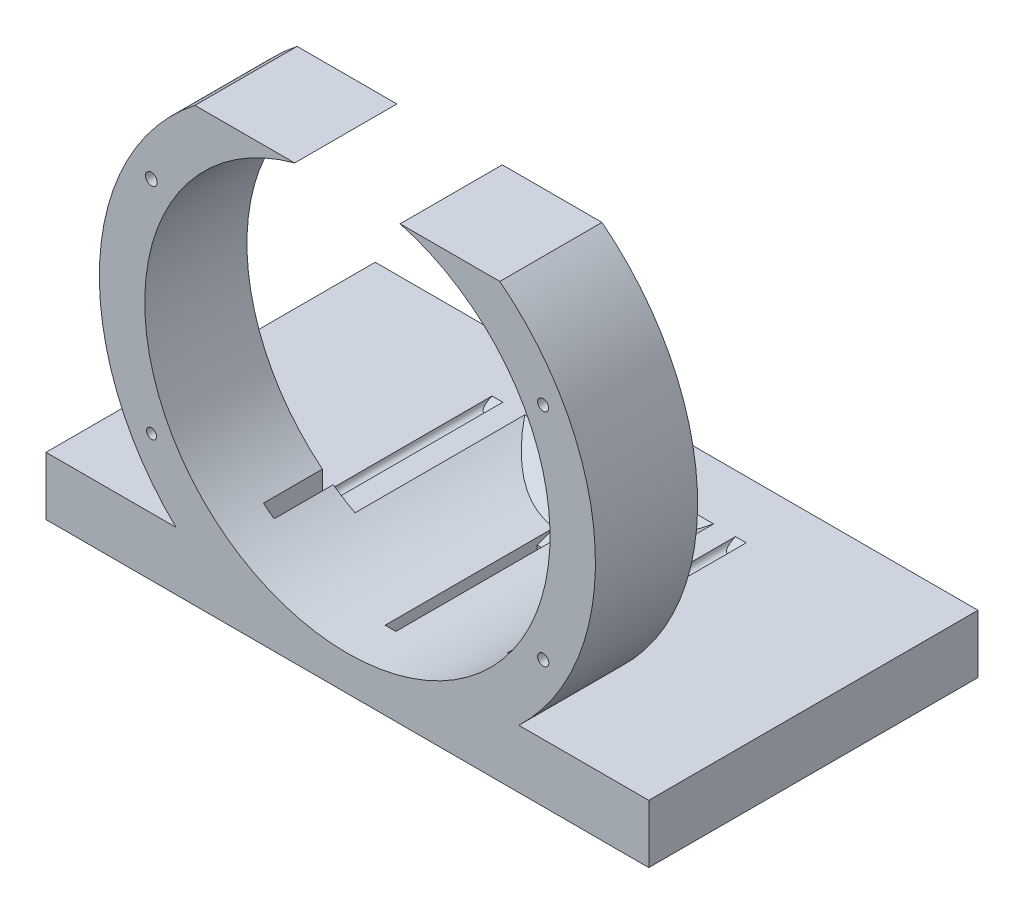
from build123d import *

# Parameters (mm, degrees)
SKETCH1_R           = 1.119854884
SKETCH1_R_2         = 1.251086703
SKETCH1_R_3         = 1.312287122
SKETCH1_R_4         = 1.226343403
BOSS_EXTRUDE1_DEPTH = 22.86
BOSS_EXTRUDE2_START = 50.8
BOSS_EXTRUDE2_DEPTH = 50.8
CUT_EXTRUDE1_DEPTH  = 13.208
BOSS_EXTRUDE3_START = -9.652
BOSS_EXTRUDE3_DEPTH = 9.652
BOSS_EXTRUDE5_DEPTH = 116.84


with BuildPart() as part:
    # Sketch1 → Boss-Extrude1 (new body)
    with BuildSketch(Plane.XY):
        with BuildLine():
            Line((-11.793911232, 43.778174686), (-34.111734376, 43.778174686))
            ThreePointArc((-34.111734376, 43.778174686), (-55.42808501, 2.8047091), (-38.356610074, -40.111213702))
            Line((-38.356610074, -40.111213702), (-67.436307144, -40.111213702))
            Line((-67.436307144, -40.111213702), (-67.436307144, -53.154130962))
            Line((-67.436307144, -53.154130962), (67.436307144, -53.154130962))
            Line((67.436307144, -53.154130962), (67.436307144, -40.111213702))
            Line((67.436307144, -40.111213702), (38.356610074, -40.111213702))
            ThreePointArc((38.356610074, -40.111213702), (55.42808501, 2.8047091), (34.111734376, 43.778174686))
            Line((34.111734376, 43.778174686), (11.793911232, 43.778174686))
            ThreePointArc((11.793911232, 43.778174686), (44.365867188, 9.343165933), (28.448, -35.303487321))
            Line((28.448, -35.303487321), (28.448, -40.084313616))
            ThreePointArc((28.448, -40.084313616), (27.2415, -41.290813616), (26.035, -40.084313616))
            Line((26.035, -40.084313616), (26.035, -37.118778213))
            ThreePointArc((26.035, -37.118778213), (14.225045371, -43.049657434), (1.2065, -45.322944286))
            Line((1.2065, -45.322944286), (1.2065, -49.1871))
            ThreePointArc((1.2065, -49.1871), (0, -50.3936), (-1.2065, -49.1871))
            Line((-1.2065, -49.1871), (-1.2065, -45.322944286))
            ThreePointArc((-1.2065, -45.322944286), (-14.225045371, -43.049657434), (-26.035, -37.118778213))
            Line((-26.035, -37.118778213), (-26.035, -40.084313616))
            ThreePointArc((-26.035, -40.084313616), (-27.2415, -41.290813616), (-28.448, -40.084313616))
            Line((-28.448, -40.084313616), (-28.448, -35.303487321))
            ThreePointArc((-28.448, -35.303487321), (-44.365867188, 9.343165933), (-11.793911232, 43.778174686))
        make_face()
        with Locations((-43.815, -24.676814501)):
            Circle(SKETCH1_R, mode=Mode.SUBTRACT)
        with Locations((43.815, -24.676814501)):
            Circle(SKETCH1_R_2, mode=Mode.SUBTRACT)
        with Locations((-43.8731923, 24.631372396)):
            Circle(SKETCH1_R_3, mode=Mode.SUBTRACT)
        with Locations((43.791398207, 24.695162459)):
            Circle(SKETCH1_R_4, mode=Mode.SUBTRACT)
    extrude(amount=BOSS_EXTRUDE1_DEPTH)

    # Sketch2 → Boss-Extrude2 (add)
    with BuildSketch(Plane(origin=(0, 0, 0), x_dir=(-1, 0, 0), z_dir=(0, 0, -1)).offset(BOSS_EXTRUDE2_START)):
        with BuildLine():
            Line((21.135644215, -40.111213702), (26.035299919, -40.111213702))
            ThreePointArc((26.035299919, -40.111213702), (27.2415, -41.290813616), (28.447700081, -40.111213702))
            Line((28.447700081, -40.111213702), (67.436307144, -40.111213702))
            Line((67.436307144, -40.111213702), (67.436307144, -53.154130962))
            Line((67.436307144, -53.154130962), (-67.436307144, -53.154130962))
            Line((-67.436307144, -53.154130962), (-67.436307144, -40.111213702))
            Line((-67.436307144, -40.111213702), (-28.447700081, -40.111213702))
            ThreePointArc((-28.447700081, -40.111213702), (-27.2415, -41.290813616), (-26.035299919, -40.111213702))
            Line((-26.035299919, -40.111213702), (-21.135644215, -40.111213702))
            ThreePointArc((-21.135644215, -40.111213702), (-11.470980165, -43.863897855), (-1.2065, -45.322944286))
            Line((-1.2065, -45.322944286), (-1.2065, -49.1871))
            ThreePointArc((-1.2065, -49.1871), (0, -50.3936), (1.2065, -49.1871))
            Line((1.2065, -49.1871), (1.2065, -45.322944286))
            ThreePointArc((1.2065, -45.322944286), (11.470980165, -43.863897855), (21.135644215, -40.111213702))
        make_face()
    extrude(amount=-BOSS_EXTRUDE2_DEPTH)

    # Sketch3 → Cut-Extrude1 (cut)
    with BuildSketch(Plane(origin=(0, 0, 0), x_dir=(-1, 0, 0), z_dir=(0, 0, -1))):
        with BuildLine():
            ThreePointArc((-26.035, 40.255386447), (-27.2415, 41.461886447), (-28.448, 40.255386447))
            Line((-28.448, 40.255386447), (-28.448, 35.270861075))
            Line((-28.448, 35.270861075), (-26.035, 37.08774892))
            Line((-26.035, 37.08774892), (-26.035, 40.255386447))
        make_face()
        with BuildLine():
            Line((28.448, 35.303487321), (28.448, 40.255386447))
            ThreePointArc((28.448, 40.255386447), (27.2415, 41.461886447), (26.035, 40.255386447))
            Line((26.035, 40.255386447), (26.079183289, 37.08774892))
            ThreePointArc((26.079183289, 37.08774892), (27.278184081, 36.214991292), (28.448, 35.303487321))
        make_face()
    extrude(amount=-CUT_EXTRUDE1_DEPTH, mode=Mode.SUBTRACT)

    # Sketch4 → Boss-Extrude3 (add)
    with BuildSketch(Plane.XY.offset(22.86).offset(BOSS_EXTRUDE3_START)):
        with BuildLine():
            ThreePointArc((-28.448, -40.084313616), (-27.2415, -41.290813616), (-26.035, -40.084313616))
            Line((-26.035, -40.084313616), (-26.035, -37.118778213))
            ThreePointArc((-26.035, -37.118778213), (-27.25661649, -36.231226566), (-28.448, -35.303487321))
            Line((-28.448, -35.303487321), (-28.448, -40.084313616))
        make_face()
        with BuildLine():
            ThreePointArc((1.2065, -45.322944286), (0, -45.339), (-1.2065, -45.322944286))
            Line((-1.2065, -45.322944286), (-1.2065, -49.1871))
            ThreePointArc((-1.2065, -49.1871), (0, -50.3936), (1.2065, -49.1871))
            Line((1.2065, -49.1871), (1.2065, -45.322944286))
        make_face()
        with BuildLine():
            ThreePointArc((26.035, -40.084313616), (27.2415, -41.290813616), (28.448, -40.084313616))
            Line((28.448, -40.084313616), (28.448, -35.303487321))
            ThreePointArc((28.448, -35.303487321), (27.25661649, -36.231226566), (26.035, -37.118778213))
            Line((26.035, -37.118778213), (26.035, -40.084313616))
        make_face()
    extrude(amount=BOSS_EXTRUDE3_DEPTH)

    # Sketch6 → Boss-Extrude5 (add)
    with BuildSketch(Plane(origin=(67.436307144, 0, 0), x_dir=(0, 0, -1), z_dir=(1, 0, 0))):
        Polygon((20.818923361, -46.823556488), (20.818923361, -53.154130962), (50.8, -53.154130962), (50.8, -45.397570332), (50.8, -40.111213702), (37.947684683, -40.111213702), align=None)
    extrude(amount=-BOSS_EXTRUDE5_DEPTH)


solid = part.part
